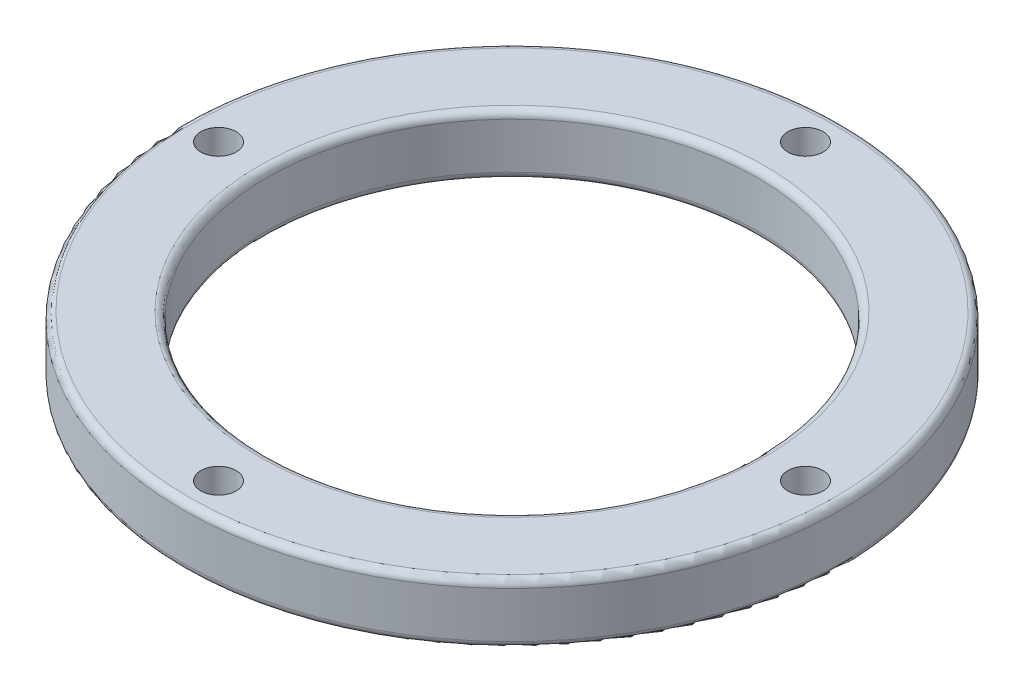
from build123d import *

# Parameters (mm, degrees)
SKETCH1_R           = 46.6
SKETCH1_R_2         = 34.7
SKETCH1_R_3         = 2.5
BOSS_EXTRUDE1_DEPTH = 8.5
FILLET1_R           = 1


with BuildPart() as part:
    # Sketch1 → Boss-Extrude1 (new body)
    with BuildSketch(Plane(origin=(0, 0, 0), x_dir=(1, 0, 0), z_dir=(0, 1, 0))):
        Circle(SKETCH1_R)
        Circle(SKETCH1_R_2, mode=Mode.SUBTRACT)
        with Locations((0, 41.5)):
            Circle(SKETCH1_R_3, mode=Mode.SUBTRACT)
        with Locations((41.5, 0)):
            Circle(SKETCH1_R_3, mode=Mode.SUBTRACT)
        with Locations((0, -41.5)):
            Circle(SKETCH1_R_3, mode=Mode.SUBTRACT)
        with Locations((-41.5, 0)):
            Circle(SKETCH1_R_3, mode=Mode.SUBTRACT)
    extrude(amount=BOSS_EXTRUDE1_DEPTH)

    # Fillet1
    fillet1_edges = [part.edges().sort_by_distance(p)[0] for p in [
        (-46.6, 0, 0),
        (-46.6, 8.5, 0),
        (-34.7, 0, 0),
        (-34.7, 8.5, 0),
    ]]
    fillet(fillet1_edges, radius=FILLET1_R)


solid = part.part
